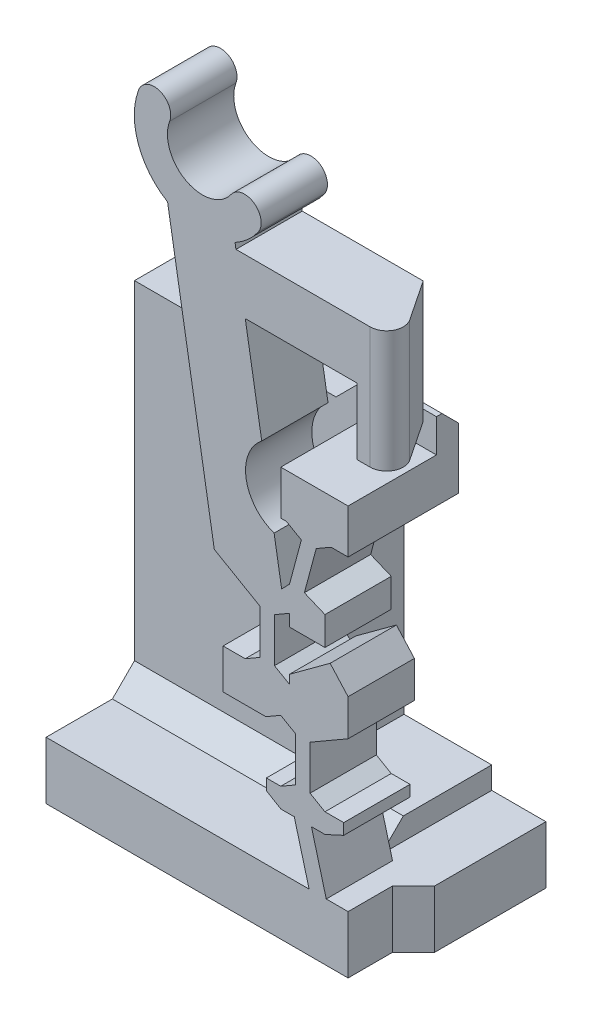
from build123d import *

# Parameters (mm, degrees)
BOSS_SWITCH_BODY_DEPTH                    = 3
SKETCH1_W                                 = 4
SKETCH1_H                                 = 3.5
BOSS_FLANGE_WIDTH_DEPTH                   = 5
BOSS_FLANGE_HEIGHT_REACH                  = 35.863
SKETCH2_W                                 = 4
SKETCH2_H                                 = 2
SKETCH2_W_2                               = 8
SKETCH2_H_2                               = 2.602328973
CUT_UP_TO_DOWN_DERAILLEUR_CLEARANCE_REACH = 21.462
SKETCH10_W                                = 2.453096586
SKETCH10_H                                = 3
SKETCH17_W                                = 12.1675
SKETCH17_H                                = 4
BOSS_FLANGE_SUPPORT_DEPTH                 = 13.897671027
TAP_DRILL_FOR_M2X0_4_TAP1_D               = 1.6
M2_CLEARANCE_HOLE2_D                      = 2.4
M2_CLEARANCE_HOLE2_DEPTH                  = 15
M2_CLEARANCE_HOLE2_TIP                    = 0.721032743
CHAMFER_FLANGE_SUPPORT_SIZE               = 1.5
CHAMFER_FLANGE_SUPPORT_2_SIZE             = 1.5
CHAMFER_FLANGE_SUPPORT_3_SIZE             = 1
SKETCH23_W                                = 3.9675
SKETCH23_H                                = 11.397671027
CUT_GAP_FOR_PRINTING_DEPTH                = 32.000499688
SKETCH25_W                                = 0.953096586
SKETCH25_H                                = 3.5
CUT_DERAILLEUR_CLEARANCE_DEPTH            = 32.145320369
CHAMFER8_SIZE                             = 1
CUT_UP_TO_DOWN_CANTILEVER_SLOPE_REACH     = 34.315
SKETCH26_W                                = 5.907653686
SKETCH26_H                                = 5.795512344
CUT_WIDE_DERAILLEUR_CLEARANCE_DEPTH       = 33.195879702
CUT_WIDE_DERAILLEUR_CLEARANCE_DEPTH_BACK  = 4
SKETCH27_W                                = 2.5
SKETCH27_H                                = 5.000000046
CHAMFER9_SIZE                             = 1.25
SKETCH28_W                                = 3.046903414
SKETCH28_H                                = 1.5
CUT_EXTRUDE1_DEPTH                        = 1
FILLET1_R                                 = 0.75


# Some blends are built 0.0001 mm under size
with BuildPart() as part:
    # Sketch-SwitchBossUp → Boss-Switch Body (new body)
    with BuildSketch(Plane.XY):
        with BuildLine():
            Line((5.581091201, 12.55524379), (5.581100766, 11.263016279))
            Line((5.581100766, 11.263016279), (3.971265023, 11.263016279))
            Line((3.971265023, 11.263016279), (3.97126394, 11.79911022))
            Line((3.97126394, 11.79911022), (3.296271341, 11.409403061))
            Line((3.296271341, 11.409403061), (3.296271341, 9.409403061))
            Line((3.296271341, 9.409403061), (3.971278743, 9.019687356))
            Line((3.971278743, 9.019687356), (3.971278743, 9.409408058))
            Line((3.971278743, 9.409408058), (5.815189336, 10.763016279))
            Line((5.815189336, 10.763016279), (6.627976927, 9.860324207))
            Line((6.627976927, 9.860324207), (6.627976927, 8.210536505))
            Line((6.627976927, 8.210536505), (5.581127833, 7.606137899))
            Line((5.581127833, 7.606137899), (4.906138119, 7.216432406))
            Line((4.906138119, 7.216432406), (4.906138119, 5.216432406))
            Line((4.906138119, 5.216432406), (5.58114552, 4.826716701))
            Line((5.58114552, 4.826716701), (6.430577026, 4.826716701))
            Line((6.430577026, 4.826716701), (6.430577026, 4.326716701))
            Line((6.430577026, 4.326716701), (5.582379266, 3.937018274))
            Line((5.582379266, 3.937018274), (4.969366686, 3.937018274))
            Line((4.969366686, 3.937018274), (5.639239667, 1.437018274))
            Line((5.639239667, 1.437018274), (6.627976927, 1.437018274))
            Line((6.627976927, 1.437018274), (6.627976927, -1.165310699))
            Line((6.627976927, -1.165310699), (3.034464198, -1.165310699))
            Line((3.034464198, -1.165310699), (3.034464198, 1.437018274))
            Line((3.034464198, 1.437018274), (4.862782532, 1.437018274))
            Line((4.862782532, 1.437018274), (4.192909551, 3.937018274))
            Line((4.192909551, 3.937018274), (3.585032728, 3.937018274))
            Line((3.585032728, 3.937018274), (2.930577026, 4.326720436))
            Line((2.930577026, 4.326720436), (2.930577026, 4.826720436))
            Line((2.930577026, 4.826720436), (3.58114552, 4.826720436))
            Line((3.58114552, 4.826720436), (4.256138119, 5.216427595))
            Line((4.256138119, 5.216427595), (4.256138119, 7.216427595))
            Line((4.256138119, 7.216427595), (3.581130717, 7.6061433))
            Line((3.581130717, 7.6061433), (2.9061262, 7.216422599))
            Line((2.9061262, 7.216422599), (0.971281627, 7.216422599))
            Line((0.971281627, 7.216422599), (0.971281627, 9.019692757))
            Line((0.971281627, 9.019692757), (1.971281627, 9.019692757))
            Line((1.971281627, 9.019692757), (2.646271341, 9.40939825))
            Line((2.646271341, 9.40939825), (2.646271341, 11.40939825))
            Line((2.646271341, 11.40939825), (1.696557212, 11.957715958))
            Line((1.696557212, 11.957715958), (0.573317845, 12.60621851))
            Line((0.573317845, 12.60621851), (-1.541303694, 25.167805745))
            ThreePointArc((-1.541303694, 25.167805745), (-2.872284003, 26.795385437), (-2.852546321, 28.897797067))
            ThreePointArc((-2.852546321, 28.897797067), (-1.887813913, 29.338582026), (-1.447028953, 28.373849618))
            ThreePointArc((-1.447028953, 28.373849618), (-0.703448682, 26.416936722), (1.333779254, 26.898727173))
            ThreePointArc((1.333779254, 26.898727173), (2.379722745, 27.074801628), (2.555797201, 26.028858137))
            ThreePointArc((2.555797201, 26.028858137), (2.086504637, 25.507104397), (1.511513111, 25.104801997))
            Line((1.511513111, 25.104801997), (1.553598189, 24.854801997))
            Line((1.553598189, 24.854801997), (9.027976927, 24.854801997))
            Line((9.027976927, 24.854801997), (9.027976927, 22.354801997))
            Line((9.027976927, 22.354801997), (9.027976927, 19.354801997))
            Line((9.027976927, 19.354801997), (7.027976927, 19.354801997))
            Line((7.027976927, 19.354801997), (7.027976927, 22.354801997))
            Line((7.027976927, 22.354801997), (1.974448974, 22.354801997))
            Line((1.974448974, 22.354801997), (2.719778232, 17.927287042))
            ThreePointArc((2.719778232, 17.927287042), (2.013826204, 16.096957693), (3.280124137, 14.598637521))
            Line((3.280124137, 14.598637521), (3.620297651, 12.577888564))
            Line((3.620297651, 12.577888564), (3.976674365, 12.944956135))
            Line((3.976674365, 12.944956135), (4.512557947, 14.944960101))
            Line((4.512557947, 14.944960101), (3.837515632, 15.334689301))
            Line((3.837515632, 15.334689301), (3.581073513, 15.334689301))
            Line((3.581073513, 15.334689301), (3.581073513, 17.334689301))
            Line((3.581073513, 17.334689301), (5.725580434, 17.334689301))
            Line((5.725580434, 17.334689301), (6.627976927, 17.334689301))
            Line((6.627976927, 17.334689301), (6.627976927, 15.334689301))
            Line((6.627976927, 15.334689301), (5.860498075, 15.334689301))
            Line((5.860498075, 15.334689301), (5.185487464, 14.944965082))
            Line((5.185487464, 14.944965082), (4.649603883, 12.944961115))
            Line((4.649603883, 12.944961115), (5.581091201, 12.55524379))
        make_face()
    extrude(amount=BOSS_SWITCH_BODY_DEPTH)

    # Sketch1 → Boss-Flange Width (add)
    with BuildSketch(Plane(origin=(0, 0, 0), x_dir=(-1, 0, 0), z_dir=(0, 0, -1))):
        Polygon((-7.581073513, -1.165310699), (0.412170615, -1.165310699), (0.412170615, 1.437018274), (-3.034464198, 1.437018274), (-4.862782532, 1.437018274), (-5.639239667, 1.437018274), (-6.627976927, 1.437018274), (-7.581073513, 1.437018274), align=None)
        with Locations((-5.581073513, 17.084689301)):
            Rectangle(SKETCH1_W, SKETCH1_H)
    extrude(amount=BOSS_FLANGE_WIDTH_DEPTH)

    # Sketch2 → Boss-Flange Height (add, up to next)
    with BuildSketch(Plane(origin=(-7.039523073, 0, 0), x_dir=(0, 0, -1), z_dir=(1, 0, 0)), mode=Mode.PRIVATE) as boss_flange_height_sk1:
        with Locations((3, 16.334689301)):
            Rectangle(SKETCH2_W, SKETCH2_H)
    boss_flange_height_tool1 = extrude(boss_flange_height_sk1.sketch, amount=BOSS_FLANGE_HEIGHT_REACH, mode=Mode.PRIVATE) - part.part
    # Sketch2 → Boss-Flange Height (add, up to next)
    with BuildSketch(Plane(origin=(-7.039523073, 0, 0), x_dir=(0, 0, -1), z_dir=(1, 0, 0)), mode=Mode.PRIVATE) as boss_flange_height_sk2:
        with Locations((1, 0.135853787)):
            Rectangle(SKETCH2_W_2, SKETCH2_H_2)
    boss_flange_height_tool2 = extrude(boss_flange_height_sk2.sketch, amount=BOSS_FLANGE_HEIGHT_REACH, mode=Mode.PRIVATE) - part.part
    add(boss_flange_height_tool1.solids().sort_by_distance((-7.039523, 16.334689, -3))[0])
    add(boss_flange_height_tool2.solids().sort_by_distance((-7.039523, 0.135854, -1))[0])

    # Sketch10 → Cut-Up-To-Down Derailleur Clearance (cut, up to next)
    with BuildSketch(Plane(origin=(0, 15.334689301, 0), x_dir=(1, 0, 0), z_dir=(0, 1, 0)), mode=Mode.PRIVATE) as cut_up_to_down_derailleur_clearance_sk1:
        with Locations((6.35452522, 3.5)):
            Rectangle(SKETCH10_W, SKETCH10_H)
    cut_up_to_down_derailleur_clearance_tool1 = extrude(cut_up_to_down_derailleur_clearance_sk1.sketch, amount=CUT_UP_TO_DOWN_DERAILLEUR_CLEARANCE_REACH, mode=Mode.PRIVATE) & part.part
    add(cut_up_to_down_derailleur_clearance_tool1.solids().sort_by_distance((6.354525, 15.334689, -3.5))[0], mode=Mode.SUBTRACT)

    # Sketch17 → Boss-Flange Support (add)
    with BuildSketch(Plane.XZ.offset(-15.334689301)):
        with Locations((-0.955773073, -3)):
            Rectangle(SKETCH17_W, SKETCH17_H)
    extrude(amount=BOSS_FLANGE_SUPPORT_DEPTH)

    # Tap Drill for M2x0.4 Tap1 (through all)
    with Locations(Plane(origin=(0, -1.165310699, 0), x_dir=(-1, 0, 0), z_dir=(0, -1, 0))):
        with Locations((5.039523073, 3), (0.539523073, 3)):
            Hole(TAP_DRILL_FOR_M2X0_4_TAP1_D / 2)

    # M2 Clearance Hole2
    with Locations(Plane.XZ.offset(1.165310699)):
        with Locations((-5.039523073, -3), (-0.539523073, -3)):
            Hole(M2_CLEARANCE_HOLE2_D / 2, depth=M2_CLEARANCE_HOLE2_DEPTH)
            with Locations((0, 0, -(M2_CLEARANCE_HOLE2_DEPTH + M2_CLEARANCE_HOLE2_TIP / 2))):  # 118° drill point
                Cone(0, M2_CLEARANCE_HOLE2_D / 2, M2_CLEARANCE_HOLE2_TIP, mode=Mode.SUBTRACT)

    # Chamfer-Flange Support
    chamfer_flange_support_edges = [part.edges().sort_by_distance(p)[0] for p in [
        (3.581073513, 17.334689301, -3),
    ]]
    chamfer(chamfer_flange_support_edges, length=CHAMFER_FLANGE_SUPPORT_SIZE - 0.0001)  # a hair under: the kernel refuses the full size

    # Chamfer-Flange Support 2
    chamfer_flange_support_2_edges = [part.edges().sort_by_distance(p)[0] for p in [
        (5.127976927, 17.084689301, -2),
        (5.127976927, 15.334689301, -1.5),
    ]]
    chamfer(chamfer_flange_support_2_edges, length=CHAMFER_FLANGE_SUPPORT_2_SIZE)

    # Chamfer-Flange Support 3
    chamfer_flange_support_3_edges = [part.edges().sort_by_distance(p)[0] for p in [
        (-0.955773073, 1.437018274, -1),
    ]]
    chamfer(chamfer_flange_support_3_edges, length=CHAMFER_FLANGE_SUPPORT_3_SIZE - 0.0001)  # a hair under: the kernel refuses the full size

    # Sketch23 → Cut-Gap for Printing (cut, through all)
    with BuildSketch(Plane.XY.offset(-1)):
        with Locations((3.144226927, 8.135853788)):
            Rectangle(SKETCH23_W, SKETCH23_H)
    extrude(amount=-CUT_GAP_FOR_PRINTING_DEPTH, mode=Mode.SUBTRACT)

    # Sketch25 → Cut-Derailleur Clearance (cut, through all)
    with BuildSketch(Plane.XY):
        with Locations((7.10452522, 17.084689301)):
            Rectangle(SKETCH25_W, SKETCH25_H)
    extrude(amount=-CUT_DERAILLEUR_CLEARANCE_DEPTH, mode=Mode.SUBTRACT)

    # Chamfer8
    # the kernel refuses this chamfer: 1 mm, written as the material it adds along each edge
    with BuildSketch(Plane(origin=(6.627976927, 1.437018274, 0), x_dir=(0.9996219169112968, 0, -0.027495876610586365), z_dir=(0, -1, 0))) as chamfer8_piece_1_section:
        Polygon((CHAMFER8_SIZE * 0.999621916911, CHAMFER8_SIZE * 0.0274958766106), (-CHAMFER8_SIZE * 0.0274958766106, CHAMFER8_SIZE * 0.999621916911), (0, 0), align=None)
    chamfer8_piece_1 = extrude(amount=2.602328973, mode=Mode.PRIVATE)
    chamfer8_piece_1 = split(chamfer8_piece_1, bisect_by=Plane(origin=(7.581073513, 0.135853788, 0.332375145), z_dir=(-1, 0, 0)), keep=Keep.TOP, mode=Mode.PRIVATE)
    add(chamfer8_piece_1)

    # Sketch26 → Cut-Up-to-Down Cantilever Slope (cut, up to next)
    with BuildSketch(Plane(origin=(4.865522488, 0, -3.243681659), x_dir=(0.5547001962252291, 0, 0.8320502943378437), z_dir=(-0.8320502943378437, 0, 0.5547001962252291)), mode=Mode.PRIVATE) as cut_up_to_down_cantilever_slope_sk1:
        with Locations((5.823012163, 21.957045825)):
            Rectangle(SKETCH26_W, SKETCH26_H)
    cut_up_to_down_cantilever_slope_tool1 = extrude(cut_up_to_down_cantilever_slope_sk1.sketch, amount=-CUT_UP_TO_DOWN_CANTILEVER_SLOPE_REACH, mode=Mode.PRIVATE) & part.part
    add(cut_up_to_down_cantilever_slope_tool1.solids().sort_by_distance((8.095548, 21.957046, 1.601357))[0], mode=Mode.SUBTRACT)

    # Sketch27 → Cut-Wide Derailleur Clearance (cut, two sides: drawn at the far end of the back side and taken through both)
    with BuildSketch(Plane(origin=(5.127976927, 0, 0), x_dir=(0, 0, -1), z_dir=(1, 0, 0)).offset(-CUT_WIDE_DERAILLEUR_CLEARANCE_DEPTH_BACK)):
        with Locations((3.75, 16.334689324)):
            Rectangle(SKETCH27_W, SKETCH27_H)
    extrude(amount=CUT_WIDE_DERAILLEUR_CLEARANCE_DEPTH + CUT_WIDE_DERAILLEUR_CLEARANCE_DEPTH_BACK, mode=Mode.SUBTRACT)

    # Chamfer9
    chamfer9_edges = [part.edges().sort_by_distance(p)[0] for p in [
        (4.85452522, 18.834689347, -2.5),
    ]]
    chamfer(chamfer9_edges, length=CHAMFER9_SIZE)

    # Sketch28 → Cut-Extrude1 (cut)
    with BuildSketch(Plane.XY.offset(-1)):
        with Locations((5.10452522, 18.084689301)):
            Rectangle(SKETCH28_W, SKETCH28_H)
    extrude(amount=CUT_EXTRUDE1_DEPTH, mode=Mode.SUBTRACT)

    # Fillet1
    fillet1_edges = [part.edges().sort_by_distance(p)[0] for p in [
        (9.027976927, 22.104801997, 3),
    ]]
    fillet(fillet1_edges, radius=FILLET1_R)


solid = part.part
